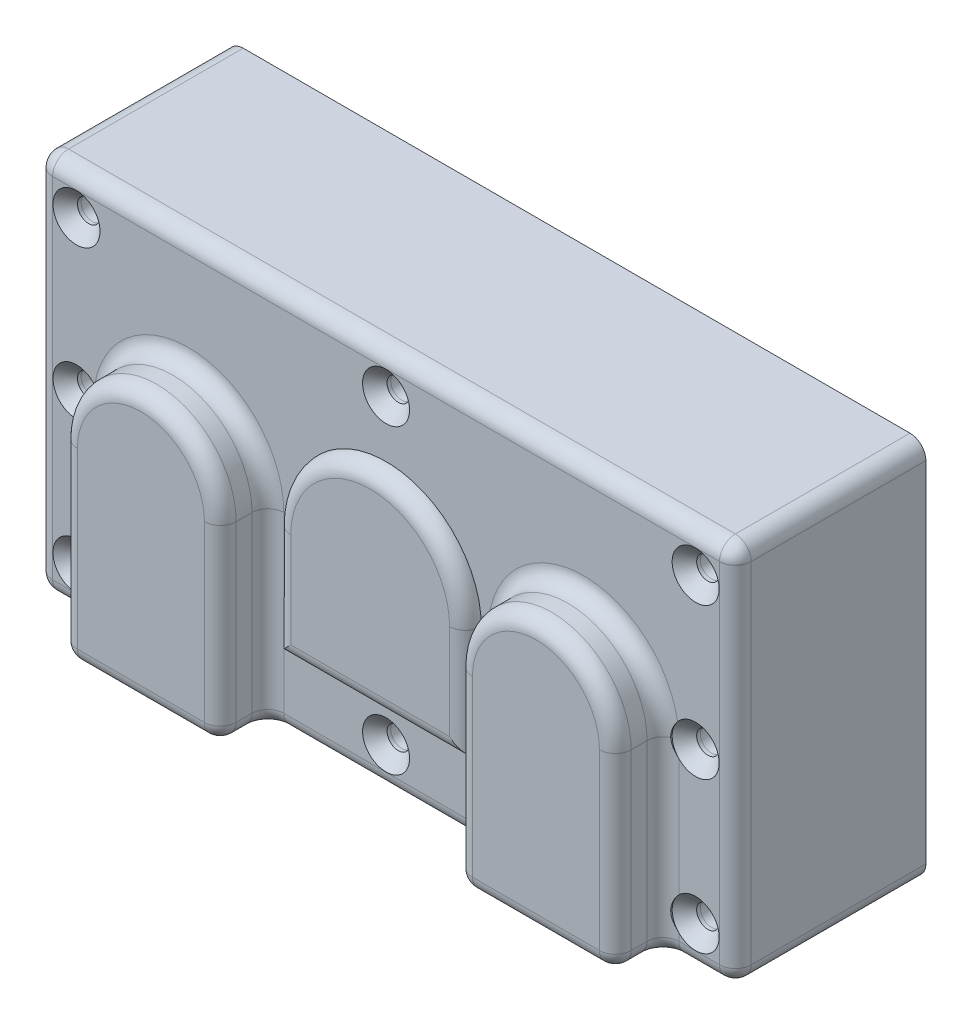
from build123d import *

# Parameters (mm, degrees)
SKETCH3_W                                      = 139.7
SKETCH3_H                                      = 76.2
BOSS_EXTRUDE1_DEPTH                            = 38.1
BOSS_EXTRUDE3_DEPTH                            = 9.525
BOSS_EXTRUDE4_DEPTH                            = 3.175
SHELL1_T                                       = -5.08
SKETCH9_R                                      = 4.041115254
BOSS_EXTRUDE2_DEPTH                            = 38.1
FILLET2_R                                      = 3.175
M4_CLEARANCE_HOLE1_D                           = 4.5
M4_CLEARANCE_HOLE1_DEPTH                       = 12.0000014
M4_CLEARANCE_HOLE1_CSINK_D                     = 4.55
M4_CLEARANCE_HOLE1_CSINK_ANGLE                 = 90
M4_CLEARANCE_HOLE1_TIP                         = 1.351936393
CSK_FOR_M4_FLAT_HEAD_MACHINE_SCREW1_AT_2_COUNT = 2
CSK_FOR_M4_FLAT_HEAD_MACHINE_SCREW1_AT_2_PITCH = 61.9125
CSK_FOR_M4_FLAT_HEAD_MACHINE_SCREW1_AT_3_COUNT = 2
CSK_FOR_M4_FLAT_HEAD_MACHINE_SCREW1_AT_3_PITCH = 123.825
CSK_FOR_M4_FLAT_HEAD_MACHINE_SCREW1_AT_4_COUNT = 2
CSK_FOR_M4_FLAT_HEAD_MACHINE_SCREW1_AT_4_PITCH = 127.445702286
CSK_FOR_M4_FLAT_HEAD_MACHINE_SCREW1_AT_5_COUNT = 2
CSK_FOR_M4_FLAT_HEAD_MACHINE_SCREW1_AT_5_PITCH = 137.737925968
CSK_FOR_M4_FLAT_HEAD_MACHINE_SCREW1_AT_6_COUNT = 2
CSK_FOR_M4_FLAT_HEAD_MACHINE_SCREW1_AT_6_PITCH = 86.442254027
CSK_FOR_M4_FLAT_HEAD_MACHINE_SCREW1_AT_7_COUNT = 2
CSK_FOR_M4_FLAT_HEAD_MACHINE_SCREW1_AT_7_PITCH = 60.325
CSK_FOR_M4_FLAT_HEAD_MACHINE_SCREW1_AT_8_COUNT = 2
CSK_FOR_M4_FLAT_HEAD_MACHINE_SCREW1_AT_8_PITCH = 30.1625
SKETCH15_R                                     = 6.35
CUT_EXTRUDE1_DEPTH                             = 5.08
HVD_TEXT_DEPTH                                 = 1.5875
HVD_TEXT_TOP_DEPTH                             = 1.5875
SKETCH21_R                                     = 4.7
CUT_EXTRUDE4_DEPTH                             = 89.217019499


with BuildPart() as part:
    # Sketch3 → Boss-Extrude1 (new body)
    with BuildSketch(Plane.XY):
        Rectangle(SKETCH3_W, SKETCH3_H)
    extrude(amount=BOSS_EXTRUDE1_DEPTH)

    # Sketch13 → Boss-Extrude3 (add)
    with BuildSketch(Plane.XY.offset(38.1)):
        with BuildLine():
            Line((-55.374686485, -38.1), (-23.624686485, -38.1))
            Line((-23.624686485, -38.1), (-23.624686485, -0.157377287))
            ThreePointArc((-23.624686485, -0.157377287), (-39.499686485, 15.717622713), (-55.374686485, -0.157377287))
            Line((-55.374686485, -0.157377287), (-55.374686485, -38.1))
        make_face()
        with BuildLine():
            ThreePointArc((55.374686485, -0.157377287), (39.499686485, 15.717622713), (23.624686485, -0.157377287))
            Line((23.624686485, -0.157377287), (23.624686485, -38.1))
            Line((23.624686485, -38.1), (55.374686485, -38.1))
            Line((55.374686485, -38.1), (55.374686485, -0.157377287))
        make_face()
    extrude(amount=BOSS_EXTRUDE3_DEPTH)

    # Sketch13<3> → Boss-Extrude4 (add)
    with BuildSketch(Plane.XY.offset(38.1)):
        with BuildLine():
            ThreePointArc((-19.05, -0.157377287), (0, 18.892622713), (19.05, -0.157377287))
            Line((19.05, -0.157377287), (19.05, -22.382377287))
            Line((19.05, -22.382377287), (-19.05, -22.382377287))
            Line((-19.05, -22.382377287), (-19.05, -0.157377287))
        make_face()
    extrude(amount=BOSS_EXTRUDE4_DEPTH)

    # Shell1
    shell1_openings = [part.faces().sort_by_distance(p)[0] for p in [
        (0, 0, 0),
    ]]
    offset(amount=SHELL1_T, openings=shell1_openings, kind=Kind.INTERSECTION)

    # Sketch9 → Boss-Extrude2 (add)
    with BuildSketch(Plane.XY):
        with Locations((-61.9125, -30.1625)):
            Circle(SKETCH9_R)
        with Locations((-61.9125, 30.1625)):
            Circle(SKETCH9_R)
        with Locations((61.9125, -30.1625)):
            Circle(SKETCH9_R)
        with Locations((61.9125, 30.1625)):
            Circle(SKETCH9_R)
        with BuildLine():
            Line((-4.041115254, 38.1), (4.041115254, 38.1))
            Line((4.041115254, 38.1), (4.041115254, 30.1625))
            ThreePointArc((4.041115254, 30.1625), (0, 26.121384746), (-4.041115254, 30.1625))
            Line((-4.041115254, 30.1625), (-4.041115254, 38.1))
        make_face()
        with BuildLine():
            Line((-61.9125, 4.041115254), (-69.85, 4.041115254))
            Line((-69.85, 4.041115254), (-69.85, -4.041115254))
            Line((-69.85, -4.041115254), (-61.9125, -4.041115254))
            ThreePointArc((-61.9125, -4.041115254), (-57.871384746, 0), (-61.9125, 4.041115254))
        make_face()
        with BuildLine():
            Line((-4.041115254, -30.1625), (-4.041115254, -38.1))
            Line((-4.041115254, -38.1), (4.041115254, -38.1))
            Line((4.041115254, -38.1), (4.041115254, -30.1625))
            ThreePointArc((4.041115254, -30.1625), (0, -26.121384746), (-4.041115254, -30.1625))
        make_face()
        with BuildLine():
            Line((69.85, 4.041115254), (69.85, -4.041115254))
            Line((69.85, -4.041115254), (61.9125, -4.041115254))
            ThreePointArc((61.9125, -4.041115254), (57.871384746, 0), (61.9125, 4.041115254))
            Line((61.9125, 4.041115254), (69.85, 4.041115254))
        make_face()
    extrude(amount=BOSS_EXTRUDE2_DEPTH)

    # O Ring Cut: sweep along a path in Sketch7
    with BuildLine(Plane(origin=(0, 0, 0), x_dir=(-1, 0, 0), z_dir=(0, 0, -1))) as o_ring_cut_path:
        Line((-64.77, 35.56), (64.77, 35.56))
        ThreePointArc((64.77, 35.56), (66.566051224, 34.816051224), (67.31, 33.02))
        Line((67.31, 33.02), (67.31, -33.02))
        ThreePointArc((67.31, -33.02), (66.566051224, -34.816051224), (64.77, -35.56))
        Line((64.77, -35.56), (-64.77, -35.56))
        ThreePointArc((-64.77, -35.56), (-66.566051224, -34.816051224), (-67.31, -33.02))
        Line((-67.31, -33.02), (-67.31, 33.02))
        ThreePointArc((-67.31, 33.02), (-66.566051224, 34.816051224), (-64.77, 35.56))
    # Sketch6 → O Ring Cut (sweep, cut)
    with BuildSketch(Plane.XZ):
        with BuildLine():
            Line((-68.6435, 1.3208), (-65.9765, 1.3208))
            Line((-65.9765, 1.3208), (-65.918832627, 0))
            ThreePointArc((-65.918832627, 0), (-67.31, -1.288794281), (-68.701167373, 0))
            Line((-68.701167373, 0), (-68.6435, 1.3208))
        make_face()
    sweep(path=o_ring_cut_path.line, mode=Mode.SUBTRACT)

    # Fillet2
    fillet2_edges = [part.edges().sort_by_distance(p)[0] for p in [
        (23.624686485, -38.1, 42.8625),
        (55.374686485, -38.1, 42.8625),
        (0, -38.1, 38.1),
        (62.612343242, -38.1, 38.1),
        (-62.612343242, -38.1, 38.1),
        (-69.85, 0, 38.1),
        (0, 38.1, 38.1),
        (55.374686485, -19.128688644, 38.1),
        (23.624686485, -19.128688644, 38.1),
        (55.374686485, -19.128688644, 47.625),
        (23.624686485, -19.128688644, 47.625),
        (-55.374686485, -19.128688644, 47.625),
        (-23.624686485, -19.128688644, 47.625),
        (-55.374686485, -19.128688644, 38.1),
        (-39.499686485, 15.717622713, 38.1),
        (39.499686485, 15.717622713, 47.625),
        (39.499686485, -38.1, 47.625),
        (-39.499686485, 15.717622713, 47.625),
        (-39.499686485, -38.1, 47.625),
        (-23.624686485, -38.1, 42.8625),
        (-55.374686485, -38.1, 42.8625),
        (69.85, 0, 38.1),
        (39.499686485, 15.717622713, 38.1),
        (-23.624686485, -19.128688644, 38.1),
        (19.05, -11.269877287, 41.275),
        (0, -22.382377287, 41.275),
        (-19.05, -11.269877287, 41.275),
        (0, 18.892622713, 41.275),
        (-69.85, -38.1, 19.05),
        (-69.85, 38.1, 19.05),
        (69.85, 38.1, 19.05),
        (69.85, -38.1, 19.05),
    ]]
    fillet(fillet2_edges, radius=FILLET2_R - 0.0001)  # a hair under: the kernel refuses the full size

    # M4 Clearance Hole1
    with Locations(Plane(origin=(0, 0, 0), x_dir=(-1, 0, 0), z_dir=(0, 0, -1))):
        with Locations((-61.9125, 0), (-61.9125, 30.1625), (0, 30.1625), (61.9125, 30.1625), (61.9125, 0), (61.9125, -30.1625), (0, -30.1625), (-61.9125, -30.1625)):
            CounterSinkHole(M4_CLEARANCE_HOLE1_D / 2, M4_CLEARANCE_HOLE1_CSINK_D / 2, depth=M4_CLEARANCE_HOLE1_DEPTH, counter_sink_angle=M4_CLEARANCE_HOLE1_CSINK_ANGLE)
            with Locations((0, 0, -(M4_CLEARANCE_HOLE1_DEPTH + M4_CLEARANCE_HOLE1_TIP / 2))):  # 118° drill point
                Cone(0, M4_CLEARANCE_HOLE1_D / 2, M4_CLEARANCE_HOLE1_TIP, mode=Mode.SUBTRACT)

    # Sketch17 → CSK for M4 Flat Head Machine Screw1 (revolve, cut)
    with BuildSketch(Plane(origin=(-61.9125, 30.1625, 38.1), x_dir=(0, -1, 0), z_dir=(1, 0, 0))):
        Polygon((0, 0), (0, 13.351937793), (2.25, 12.0000014), (2.25, 2.45), (4.7, 0), align=None)
    csk_for_m4_flat_head_machine_screw1 = revolve(axis=Axis((-61.9125, 30.1625, 44.45), (0, 0, -1)), mode=Mode.SUBTRACT)

    # CSK for M4 Flat Head Machine Screw1 at 2: CSK for M4 Flat Head Machine Screw1 ×2
    with Locations(*[(i * CSK_FOR_M4_FLAT_HEAD_MACHINE_SCREW1_AT_2_PITCH, 0, 0) for i in range(1, CSK_FOR_M4_FLAT_HEAD_MACHINE_SCREW1_AT_2_COUNT)]):
        add(csk_for_m4_flat_head_machine_screw1, mode=Mode.SUBTRACT)

    # CSK for M4 Flat Head Machine Screw1 at 3: CSK for M4 Flat Head Machine Screw1 ×2
    with Locations(*[(i * CSK_FOR_M4_FLAT_HEAD_MACHINE_SCREW1_AT_3_PITCH, 0, 0) for i in range(1, CSK_FOR_M4_FLAT_HEAD_MACHINE_SCREW1_AT_3_COUNT)]):
        add(csk_for_m4_flat_head_machine_screw1, mode=Mode.SUBTRACT)

    # CSK for M4 Flat Head Machine Screw1 at 4: CSK for M4 Flat Head Machine Screw1 ×2
    with Locations(*[Vector(0.9715902363017852, -0.23666941653505028, 0) * (i * CSK_FOR_M4_FLAT_HEAD_MACHINE_SCREW1_AT_4_PITCH) for i in range(1, CSK_FOR_M4_FLAT_HEAD_MACHINE_SCREW1_AT_4_COUNT)]):
        add(csk_for_m4_flat_head_machine_screw1, mode=Mode.SUBTRACT)

    # CSK for M4 Flat Head Machine Screw1 at 5: CSK for M4 Flat Head Machine Screw1 ×2
    with Locations(*[Vector(0.8989898688372695, -0.4379694232796955, 0) * (i * CSK_FOR_M4_FLAT_HEAD_MACHINE_SCREW1_AT_5_PITCH) for i in range(1, CSK_FOR_M4_FLAT_HEAD_MACHINE_SCREW1_AT_5_COUNT)]):
        add(csk_for_m4_flat_head_machine_screw1, mode=Mode.SUBTRACT)

    # CSK for M4 Flat Head Machine Screw1 at 6: CSK for M4 Flat Head Machine Screw1 ×2
    with Locations(*[Vector(0.7162295881449136, -0.6978647269104289, 0) * (i * CSK_FOR_M4_FLAT_HEAD_MACHINE_SCREW1_AT_6_PITCH) for i in range(1, CSK_FOR_M4_FLAT_HEAD_MACHINE_SCREW1_AT_6_COUNT)]):
        add(csk_for_m4_flat_head_machine_screw1, mode=Mode.SUBTRACT)

    # CSK for M4 Flat Head Machine Screw1 at 7: CSK for M4 Flat Head Machine Screw1 ×2
    with Locations(*[(0, -i * CSK_FOR_M4_FLAT_HEAD_MACHINE_SCREW1_AT_7_PITCH, 0) for i in range(1, CSK_FOR_M4_FLAT_HEAD_MACHINE_SCREW1_AT_7_COUNT)]):
        add(csk_for_m4_flat_head_machine_screw1, mode=Mode.SUBTRACT)

    # CSK for M4 Flat Head Machine Screw1 at 8: CSK for M4 Flat Head Machine Screw1 ×2
    with Locations(*[(0, -i * CSK_FOR_M4_FLAT_HEAD_MACHINE_SCREW1_AT_8_PITCH, 0) for i in range(1, CSK_FOR_M4_FLAT_HEAD_MACHINE_SCREW1_AT_8_COUNT)]):
        add(csk_for_m4_flat_head_machine_screw1, mode=Mode.SUBTRACT)

    # Sketch15 → Cut-Extrude1 (cut)
    with BuildSketch(Plane.XZ.offset(38.1)):
        with Locations(Location((-39.499686485, 34.6, 0), (0, 0, 270))):
            Circle(SKETCH15_R)
        with Locations(Location((39.499686485, 34.6, 0), (0, 0, 270))):
            Circle(SKETCH15_R)
    extrude(amount=-CUT_EXTRUDE1_DEPTH, mode=Mode.SUBTRACT)

    # Sketch19 → HVD text (cut)
    # profile 1 of 3: a face of its own
    with BuildSketch(Plane.XZ.offset(38.1)):
        Polygon((-25.277884615, 28.575), (-21.858653846, 28.575), (-21.858653846, 21.248076923), (-15.264423077, 21.248076923), (-15.264423077, 28.575), (-11.845192308, 28.575), (-11.845192308, 9.525), (-15.264423077, 9.525), (-15.264423077, 17.828846154), (-21.858653846, 17.828846154), (-21.858653846, 9.525), (-25.277884615, 9.525), align=None)
    # profile 2 of 3: a face of its own
    with BuildSketch(Plane.XZ.offset(38.1)):
        Polygon((-9.036538462, 28.575), (-5.38452524, 28.575), (-0.488461538, 15.043088942), (4.419050481, 28.575), (8.059615385, 28.575), (1.152463942, 9.525), (-2.140835337, 9.525), align=None)
    # profile 3 of 3: a face of its own
    with BuildSketch(Plane.XZ.offset(38.1)):
        with BuildLine():
            Line((11.1125, 28.575), (15.420883413, 28.575))
            add(Edge.make_bspline(
                [(15.420883413, 28.575), (15.756771456, 28.572652028), (16.406046839, 28.568113371), (17.346718421, 28.516973619), (18.221423289, 28.438324313), (19.030725296, 28.330127938), (19.772965242, 28.186954506), (20.447186024, 28.007371496), (21.055650487, 27.800072787), (21.605030319, 27.556143791), (22.106561265, 27.271746807), (22.582780904, 26.954951399), (23.032754191, 26.594152425), (23.462795789, 26.196310418), (23.86735592, 25.754146979), (24.25317196, 25.274985938), (24.61079738, 24.751878797), (24.951042425, 24.197368017), (25.258748793, 23.609103634), (25.527141785, 22.992092831), (25.751976222, 22.350306304), (25.934665845, 21.683060074), (26.080290559, 20.992569196), (26.182181236, 20.277440324), (26.245171068, 19.538335548), (26.25156086, 19.037407951), (26.254807692, 18.782872596)],
                knots=[0, 0, 0, 0, 1.44355588, 2.790409838, 4.047694926, 5.217575253, 6.298404546, 7.294384826, 8.214239204, 9.058592145, 9.873746385, 10.689560431, 11.514393297, 12.350027578, 13.205127629, 14.088021785, 14.991911688, 15.926770944, 16.882954281, 17.842803888, 18.816321264, 19.80318086, 20.814351908, 21.847355356, 22.906180909, 24, 24, 24, 24], degree=3))
            add(Edge.make_bspline(
                [(26.254807692, 18.782872596), (26.246305732, 18.423706642), (26.229569127, 17.716667438), (26.08858931, 16.679095551), (25.860577211, 15.684479411), (25.539971491, 14.740599293), (25.142506221, 13.855860586), (24.667689449, 13.045865288), (24.122483094, 12.314961042), (23.513238842, 11.666787153), (22.853575699, 11.109672911), (22.168052671, 10.632545332), (21.449991514, 10.256290424), (20.817279284, 10.017688546), (20.268638845, 9.869298821), (19.786938475, 9.781599065), (19.239776004, 9.701173099), (18.622049618, 9.639021643), (17.936469147, 9.583597818), (17.180301861, 9.553482668), (16.355996011, 9.528461449), (15.78343766, 9.526184049), (15.485757212, 9.525)],
                knots=[0, 0, 0, 0, 1.315458931, 2.589557908, 3.828601765, 5.048913369, 6.235739168, 7.376350998, 8.481830359, 9.569842114, 10.627874879, 11.640079404, 12.624025415, 13.590060155, 14.111227486, 14.704434459, 15.382649715, 16.137166398, 16.978595427, 17.902333227, 18.909396075, 20, 20, 20, 20], degree=3))
            Line((15.485757212, 9.525), (11.1125, 9.525))
            Line((11.1125, 9.525), (11.1125, 28.575))
        make_face()
        with BuildLine():
            Line((14.531730769, 25.155769231), (14.531730769, 12.944230769))
            Line((14.531730769, 12.944230769), (16.317668269, 12.944230769))
            add(Edge.make_bspline(
                [(16.317668269, 12.944230769), (16.530167404, 12.944620156), (16.938873981, 12.945369075), (17.528953764, 12.981040765), (18.074627944, 13.016845305), (18.574394408, 13.084803518), (19.0318903, 13.160504186), (19.440830825, 13.265852031), (19.809646024, 13.376511017), (20.133830892, 13.517393623), (20.430757816, 13.675966371), (20.705678232, 13.86175273), (20.971053405, 14.068061474), (21.221921932, 14.300960438), (21.45923329, 14.557365602), (21.681583396, 14.838598107), (21.891940035, 15.143799905), (22.084903749, 15.474584674), (22.261235024, 15.827459252), (22.417660624, 16.199005534), (22.547360529, 16.5923177), (22.655159149, 17.003713876), (22.732193486, 17.436775731), (22.795924708, 17.888295638), (22.828780009, 18.360062479), (22.833289195, 18.681068405), (22.835576923, 18.843930288)],
                knots=[0, 0, 0, 0, 1.50275155, 2.890291501, 4.180787663, 5.369391935, 6.45668281, 7.458360028, 8.354766181, 9.177074746, 9.954075863, 10.732690366, 11.5210699, 12.329727389, 13.151100085, 13.990027547, 14.863562427, 15.770965086, 16.696477834, 17.652329173, 18.619756807, 19.62365428, 20.657822005, 21.729286259, 22.847956731, 24, 24, 24, 24], degree=3))
            add(Edge.make_bspline(
                [(22.835576923, 18.843930288), (22.831020545, 19.093500729), (22.822135959, 19.580143749), (22.736454942, 20.288949931), (22.596982592, 20.956397135), (22.397968985, 21.580008286), (22.147106166, 22.161536059), (21.83309287, 22.69605368), (21.46944302, 23.192540311), (21.18187864, 23.4837953), (21.038191106, 23.629326923)],
                knots=[0, 0, 0, 0, 1.13821349, 2.219428113, 3.251817212, 4.244760574, 5.201143372, 6.134805572, 7.068016741, 8, 8, 8, 8], degree=3))
            add(Edge.make_bspline(
                [(21.038191106, 23.629326923), (20.896501592, 23.75333954), (20.607116803, 24.006621269), (20.099052212, 24.310117552), (19.539191345, 24.576768785), (18.914726264, 24.788193475), (18.231692149, 24.955397133), (17.486020833, 25.070713408), (16.681705547, 25.144814423), (16.124494658, 25.152039396), (15.836838942, 25.155769231)],
                knots=[0, 0, 0, 0, 0.813307809, 1.661089106, 2.549956539, 3.493439533, 4.508053171, 5.589449661, 6.755572447, 8, 8, 8, 8], degree=3))
            Line((15.836838942, 25.155769231), (14.531730769, 25.155769231))
        make_face(mode=Mode.SUBTRACT)
    extrude(amount=-HVD_TEXT_DEPTH, mode=Mode.SUBTRACT)

    # Sketch22 → HVD text top (cut)
    # profile 1 of 3: a face of its own
    with BuildSketch(Plane.ZY.offset(69.85)):
        with BuildLine():
            Line((28.575, -12.7), (28.575, -17.008383413))
            add(Edge.make_bspline(
                [(28.575, -17.008383413), (28.572651902, -17.344271403), (28.568113001, -17.993546684), (28.516974947, -18.934218976), (28.438319828, -19.808921413), (28.330142931, -20.61823157), (28.186904836, -21.360444457), (28.007535759, -22.034754763), (27.799153071, -22.644023635), (27.556987311, -23.195407898), (27.272830575, -23.697370536), (26.953629429, -24.170626659), (26.59455215, -24.620631903), (26.194774302, -25.049882206), (25.756950871, -25.459423085), (25.272266782, -25.839641068), (24.753275757, -26.202725625), (24.198176579, -26.542785688), (23.60806513, -26.845481615), (22.992229347, -27.114914926), (22.350268977, -27.339401538), (21.683070401, -27.522186508), (20.992566336, -27.667784838), (20.277441114, -27.769682817), (19.538335341, -27.832670654), (19.037407881, -27.83906072), (18.782872596, -27.842307692)],
                knots=[0, 0, 0, 0, 1.443473934, 2.790251435, 4.047465151, 5.217279069, 6.298047006, 7.293970747, 8.213772908, 9.063072335, 9.878180301, 10.689410498, 11.514196541, 12.349783386, 13.208549609, 14.087984609, 14.994942826, 15.929749014, 16.883358292, 17.843153412, 18.816615524, 19.8034191, 20.814532747, 21.847477555, 22.906243002, 24, 24, 24, 24], degree=3))
            add(Edge.make_bspline(
                [(18.782872596, -27.842307692), (18.423706269, -27.833806226), (17.71666633, -27.817070593), (16.679099772, -27.676083725), (15.684464149, -27.448097404), (14.740654717, -27.127398156), (13.855663221, -26.730267363), (13.047217618, -26.254654206), (12.313669836, -25.714220974), (11.667191498, -25.104171894), (11.108131038, -24.44468074), (10.634919452, -23.756651457), (10.255062185, -23.040702137), (10.017908193, -22.408515743), (9.868720312, -21.858802266), (9.782514648, -21.376823424), (9.700399617, -20.828655892), (9.639410047, -20.210774448), (9.583509312, -19.523980358), (9.553509598, -18.767798449), (9.5284538, -17.94349698), (9.526181433, -17.370937991), (9.525, -17.073257212)],
                knots=[0, 0, 0, 0, 1.315357893, 2.589359008, 3.828307697, 5.048525571, 6.235260212, 7.375784434, 8.478395391, 9.566323578, 10.624275077, 11.640246088, 12.619991216, 13.585951757, 14.107079058, 14.704817694, 15.378369799, 16.137463096, 16.978827496, 17.902494345, 18.909479843, 20, 20, 20, 20], degree=3))
            Line((9.525, -17.073257212), (9.525, -12.7))
            Line((9.525, -12.7), (28.575, -12.7))
        make_face()
        with BuildLine():
            Line((25.155769231, -16.119230769), (12.944230769, -16.119230769))
            Line((12.944230769, -16.119230769), (12.944230769, -17.905168269))
            add(Edge.make_bspline(
                [(12.944230769, -17.905168269), (12.944620156, -18.117667404), (12.945369075, -18.526373981), (12.981040765, -19.116453764), (13.016845305, -19.662127944), (13.084803518, -20.161894408), (13.160504186, -20.6193903), (13.265852031, -21.028330825), (13.376511017, -21.397146025), (13.517393623, -21.721330891), (13.675966371, -22.018257818), (13.861752732, -22.293178224), (14.068061467, -22.558553436), (14.300960467, -22.809421812), (14.557365491, -23.046733749), (14.838598537, -23.269081615), (15.143798201, -23.479447097), (15.474591357, -23.672376058), (15.827433436, -23.848841984), (16.199105839, -24.004745046), (16.591634732, -24.136355776), (17.004846371, -24.236301303), (17.436176597, -24.321441722), (17.888398729, -24.382919635), (18.360035332, -24.416413013), (18.681059268, -24.420833961), (18.843930288, -24.423076923)],
                knots=[0, 0, 0, 0, 1.502785267, 2.890356349, 4.180881464, 5.369512404, 6.456827674, 7.458527365, 8.354953631, 9.177280646, 9.954299195, 10.732931168, 11.52132839, 12.330004022, 13.151395147, 13.990341431, 14.86389591, 15.771318928, 16.696852441, 17.652725226, 18.620174565, 19.621874256, 20.657747019, 21.729235313, 22.847930884, 24, 24, 24, 24], degree=3))
            add(Edge.make_bspline(
                [(18.843930288, -24.423076923), (19.093500729, -24.418520545), (19.580143749, -24.409635959), (20.288949931, -24.323954942), (20.956397135, -24.184482592), (21.580008286, -23.985468985), (22.161536059, -23.734606166), (22.69605368, -23.42059287), (23.192540311, -23.05694302), (23.4837953, -22.76937864), (23.629326923, -22.625691106)],
                knots=[0, 0, 0, 0, 1.13821349, 2.219428113, 3.251817212, 4.244760574, 5.201143372, 6.134805572, 7.068016741, 8, 8, 8, 8], degree=3))
            add(Edge.make_bspline(
                [(23.629326923, -22.625691106), (23.75333954, -22.484001592), (24.006621269, -22.194616803), (24.310117552, -21.686552212), (24.576768785, -21.126691345), (24.788193475, -20.502226264), (24.955397133, -19.819192149), (25.070713408, -19.073520833), (25.144814423, -18.269205547), (25.152039396, -17.711994658), (25.155769231, -17.424338942)],
                knots=[0, 0, 0, 0, 0.813307809, 1.661089106, 2.549956539, 3.493439533, 4.508053171, 5.589449661, 6.755572447, 8, 8, 8, 8], degree=3))
            Line((25.155769231, -17.424338942), (25.155769231, -16.119230769))
        make_face(mode=Mode.SUBTRACT)
    # profile 2 of 3: a face of its own
    with BuildSketch(Plane.ZY.offset(69.85)):
        Polygon((28.575, 7.449038462), (28.575, 3.79702524), (15.043088942, -1.099038462), (28.575, -6.006550481), (28.575, -9.647115385), (9.525, -2.739963942), (9.525, 0.553335337), align=None)
    # profile 3 of 3: a face of its own
    with BuildSketch(Plane.ZY.offset(69.85)):
        Polygon((28.575, 23.690384615), (28.575, 20.271153846), (21.248076923, 20.271153846), (21.248076923, 13.676923077), (28.575, 13.676923077), (28.575, 10.257692308), (9.525, 10.257692308), (9.525, 13.676923077), (17.828846154, 13.676923077), (17.828846154, 20.271153846), (9.525, 20.271153846), (9.525, 23.690384615), align=None)
    extrude(amount=-HVD_TEXT_TOP_DEPTH, mode=Mode.SUBTRACT)

    # Sketch21 → Cut-Extrude4 (cut, through all)
    with BuildSketch(Plane.XY.offset(38.1)):
        with Locations((-61.9125, -30.1625)):
            Circle(SKETCH21_R)
        with Locations((-61.9125, 0)):
            Circle(SKETCH21_R)
        with Locations((61.9125, -30.1625)):
            Circle(SKETCH21_R)
        with Locations((61.9125, 0)):
            Circle(SKETCH21_R)
    extrude(amount=CUT_EXTRUDE4_DEPTH, mode=Mode.SUBTRACT)


with BuildPart() as body_2:
    # Split2: the piece on the far side of the plane
    add(part.part)
    split(bisect_by=Plane(origin=(0, 0, 34.925), x_dir=(-1, 0, 0), z_dir=(0, 0, -1)), keep=Keep.BOTTOM)


with BuildPart() as part_1:
    add(part.part)

    # Split2
    split(bisect_by=Plane(origin=(0, 0, 34.925), x_dir=(-1, 0, 0), z_dir=(0, 0, -1)), keep=Keep.TOP)


solid = Compound([body_2.part, part_1.part])
